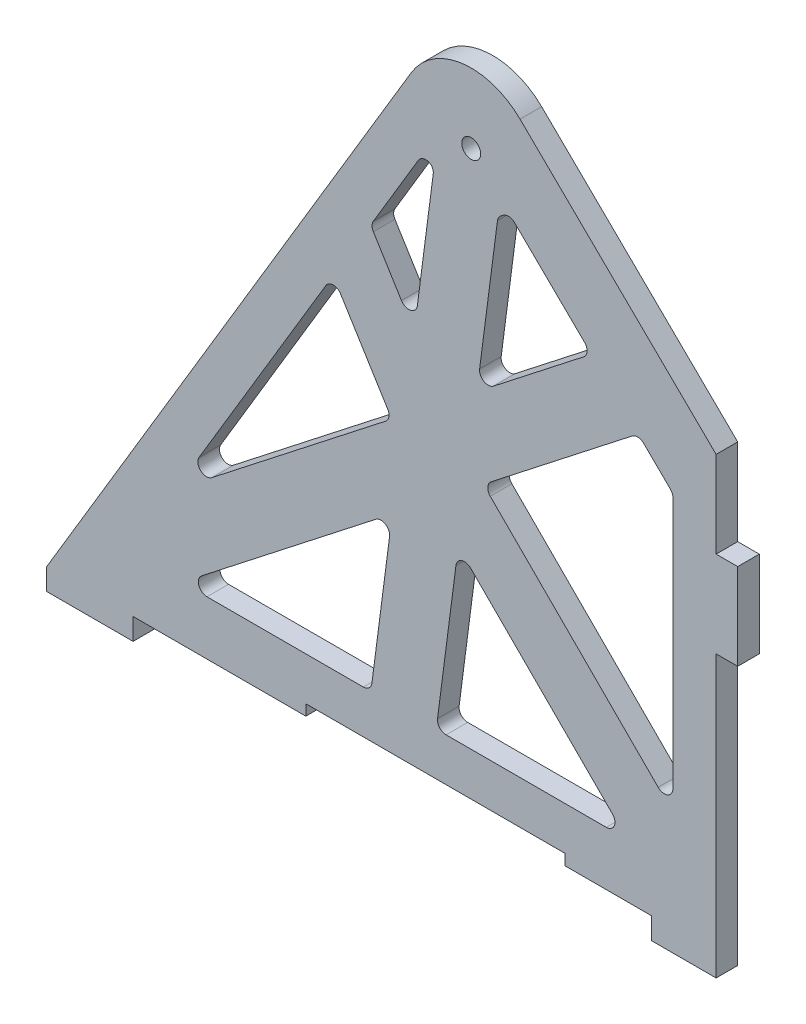
from build123d import *

# Parameters (mm, degrees)
SKETCH2_R           = 2.778125
BOSS_EXTRUDE1_DEPTH = 6.35
CUT_EXTRUDE1_DEPTH  = 280.596929737
FILLET1_R           = 2.54


with BuildPart() as part:
    # Sketch2 → Boss-Extrude1 (new body)
    with BuildSketch(Plane.XY):
        with BuildLine():
            Line((25.4, 2.542062626), (76.2, 2.542062626))
            Line((76.2, 2.542062626), (76.2, 5.717062626))
            Line((76.2, 5.717062626), (152.4, 5.717062626))
            Line((152.4, 5.717062626), (152.4, 2.542062626))
            Line((152.4, 2.542062626), (177.8, 2.542062626))
            Line((177.8, 2.542062626), (177.8, -3.807937374))
            Line((177.8, -3.807937374), (196.85, -3.807937374))
            Line((196.85, -3.807937374), (196.85, 78.742062626))
            Line((196.85, 78.742062626), (203.2, 78.742062626))
            Line((203.2, 78.742062626), (203.2, 104.142062626))
            Line((203.2, 104.142062626), (196.85, 104.142062626))
            Line((196.85, 104.142062626), (196.85, 129.542062626))
            Line((196.85, 129.542062626), (139.204596213, 186.076487834))
            ThreePointArc((139.204596213, 186.076487834), (122.208232851, 191.779061014), (107.214428724, 181.951469947))
            Line((107.214428724, 181.951469947), (0, 2.542062626))
            Line((0, 2.542062626), (0, -3.807937374))
            Line((0, -3.807937374), (25.4, -3.807937374))
            Line((25.4, -3.807937374), (25.4, 2.542062626))
        make_face()
        with Locations((124.833126, 171.422598626)):
            Circle(SKETCH2_R, mode=Mode.SUBTRACT)
    extrude(amount=BOSS_EXTRUDE1_DEPTH)

    # Sketch4 → Cut-Extrude1 (cut, through all)
    with BuildSketch(Plane.XY.offset(6.35)):
        with BuildLine():
            ThreePointArc((113.815309866, 160.551532388), (112.421969705, 162.174055338), (111.26558656, 163.973153877))
            Line((111.26558656, 163.973153877), (95.241664491, 137.159203595))
            Line((95.241664491, 137.159203595), (108.075962418, 116.386657845))
            Line((108.075962418, 116.386657845), (113.815309866, 160.551532388))
        make_face()
        with BuildLine():
            Line((160.218857543, 136.71884322), (135.883782706, 160.584917146))
            ThreePointArc((135.883782706, 160.584917146), (134.376571421, 159.23674605), (132.706463437, 158.096574796))
            Line((132.706463437, 158.096574796), (126.50513789, 110.376730818))
            Line((126.50513789, 110.376730818), (160.218857543, 136.71884322))
        make_face()
        Polygon((101.478261059, 90.822056657), (84.231843224, 118.735699112), (37.832728657, 41.092813319), align=None)
        Polygon((184.15, 113.248916833), (173.938776136, 123.263343551), (128.409628791, 87.689282626), (184.15, 31.894074467), align=None)
        Polygon((101.62722196, 66.762930434), (39.752190498, 18.417062626), (95.344542887, 18.417062626), align=None)
        Polygon((170.686233709, 18.417062626), (121.01587543, 68.136286224), (114.554724978, 18.417062626), align=None)
    extrude(amount=-CUT_EXTRUDE1_DEPTH, mode=Mode.SUBTRACT)

    # Fillet1
    # the kernel refuses this fillet: 2.54 mm, written as the material it adds along each edge
    with BuildSketch(Plane(origin=(101.478261059, 90.822056657, 6.35), x_dir=(-0.787987305363456, -0.6156914865304209, 0), z_dir=(0, 0, -1))) as fillet1_piece_1:
        with BuildLine():
            CenterArc((FILLET1_R * 0.89579463255, FILLET1_R), FILLET1_R, 186.292375304, 83.707624696)
            Line((-FILLET1_R * 0.0981809171118, FILLET1_R * 0.890397962274), (0, 0))
            Line((0, 0), (FILLET1_R * 0.89579463255, 0))
        make_face()
    extrude(amount=6.35)
    with BuildSketch(Plane(origin=(37.832728657, 41.092813319, 6.35), x_dir=(0.7879873053634544, 0.615691486530423, 0), z_dir=(0, 0, -1))) as fillet1_piece_2:
        with BuildLine():
            CenterArc((FILLET1_R * 5.36015588483, -FILLET1_R), FILLET1_R, 90, 158.864572417)
            Line((FILLET1_R * 4.9995822743, -FILLET1_R * 1.9327307604), (0, 0))
            Line((0, 0), (FILLET1_R * 5.36015588483, 0))
        make_face()
    extrude(amount=6.35)
    with BuildSketch(Plane(origin=(84.231843224, 118.735699112, 6.35), x_dir=(0.5256172693760891, -0.8507211565099483, 0), z_dir=(0, 0, -1))) as fillet1_piece_3:
        with BuildLine():
            CenterArc((FILLET1_R * 1.64561036796, FILLET1_R), FILLET1_R, 152.572197113, 117.427802887)
            Line((FILLET1_R * 0.758018400173, FILLET1_R * 1.46063054471), (0, 0))
            Line((0, 0), (FILLET1_R * 1.64561036796, 0))
        make_face()
    extrude(amount=6.35)
    with BuildSketch(Plane(origin=(111.26558656, 163.973153877, 6.35), x_dir=(-0.5129778962436395, -0.8584018161475719, 0), z_dir=(0, 0, -1))) as fillet1_piece_4:
        with BuildLine():
            CenterArc((3.871144204, -2.54), FILLET1_R, 90, 107.056570321)
            ThreePointArc((1.442864529, -3.285022026), (0.816940233, -1.600561505), (0, 0))
            Line((0, 0), (3.871144204, 0))
        make_face()
    extrude(amount=6.35)
    with BuildSketch(Plane(origin=(113.815309866, 160.551532388, 6.35), x_dir=(-0.12886916491369038, -0.9916616047495476, 0), z_dir=(0, 0, -1))) as fillet1_piece_5:
        with BuildLine():
            CenterArc((1.182123264, 2.54), FILLET1_R, 222.036471985, 47.963528015)
            ThreePointArc((-0.704382325, 0.839207048), (-0.344763298, 0.425838049), (0, 0))
            Line((0, 0), (1.182123264, 0))
        make_face()
    extrude(amount=6.35)
    with BuildSketch(Plane(origin=(108.075962418, 116.386657845, 6.35), x_dir=(-0.5256172693760838, 0.8507211565099515, 0), z_dir=(0, 0, -1))) as fillet1_piece_6:
        with BuildLine():
            CenterArc((FILLET1_R * 2.81500526937, FILLET1_R), FILLET1_R, 129.114057402, 140.885942598)
            Line((FILLET1_R * 2.18413907953, FILLET1_R * 1.77589164869), (0, 0))
            Line((0, 0), (FILLET1_R * 2.81500526937, 0))
        make_face()
    extrude(amount=6.35)
    with BuildSketch(Plane(origin=(95.241664491, 137.159203595, 6.35), x_dir=(0.5129778962436408, 0.8584018161475709, 0), z_dir=(0, 0, -1))) as fillet1_piece_7:
        with BuildLine():
            CenterArc((FILLET1_R * 0.607677260346, FILLET1_R), FILLET1_R, 207.427802887, 62.572197113)
            Line((-FILLET1_R * 0.279914707441, FILLET1_R * 0.539369455291), (0, 0))
            Line((0, 0), (FILLET1_R * 0.607677260346, 0))
        make_face()
    extrude(amount=6.35)
    with BuildSketch(Plane(origin=(39.752190498, 18.417062626, 6.35), x_dir=(0.787987305363458, 0.6156914865304186, 0), z_dir=(0, 0, -1))) as fillet1_piece_8:
        with BuildLine():
            CenterArc((FILLET1_R * 2.9040312307, FILLET1_R), FILLET1_R, 128.002182129, 141.997817871)
            Line((FILLET1_R * 2.28833974417, FILLET1_R * 1.78798730536), (0, 0))
            Line((0, 0), (FILLET1_R * 2.9040312307, 0))
        make_face()
    extrude(amount=6.35)
    with BuildSketch(Plane(origin=(101.62722196, 66.762930434, 6.35), x_dir=(-0.7879873053634603, -0.6156914865304155, 0), z_dir=(0, 0, -1))) as fillet1_piece_9:
        with BuildLine():
            CenterArc((FILLET1_R * 2.438641865, -FILLET1_R), FILLET1_R, 90, 135.406432707)
            Line((FILLET1_R * 1.73656875695, -FILLET1_R * 1.71210487357), (0, 0))
            Line((0, 0), (FILLET1_R * 2.438641865, 0))
        make_face()
    extrude(amount=6.35)
    with BuildSketch(Plane(origin=(95.344542887, 18.417062626, 6.35), x_dir=(-1, 0, 0), z_dir=(0, 0, -1))) as fillet1_piece_10:
        with BuildLine():
            CenterArc((FILLET1_R * 0.878455746309, FILLET1_R), FILLET1_R, 187.404250578, 82.595749422)
            Line((-FILLET1_R * 0.11320585844, FILLET1_R * 0.871130835086), (0, 0))
            Line((0, 0), (FILLET1_R * 0.878455746309, 0))
        make_face()
    extrude(amount=6.35)
    with BuildSketch(Plane(origin=(121.01587543, 68.136286224, 6.35), x_dir=(0.7067590436590283, -0.7074543477894356, 0), z_dir=(0, 0, -1))) as fillet1_piece_11:
        with BuildLine():
            CenterArc((FILLET1_R * 2.03333963012, FILLET1_R), FILLET1_R, 142.376080862, 127.623919138)
            Line((FILLET1_R * 1.2413047717, FILLET1_R * 1.61047586606), (0, 0))
            Line((0, 0), (FILLET1_R * 2.03333963012, 0))
        make_face()
    extrude(amount=6.35)
    with BuildSketch(Plane(origin=(170.686233709, 18.417062626, 6.35), x_dir=(-1, 0, 0), z_dir=(0, 0, -1))) as fillet1_piece_12:
        with BuildLine():
            CenterArc((FILLET1_R * 2.41253594524, FILLET1_R), FILLET1_R, 135.028169716, 134.971830284)
            Line((FILLET1_R * 1.70508159745, FILLET1_R * 1.70675904366), (0, 0))
            Line((0, 0), (FILLET1_R * 2.41253594524, 0))
        make_face()
    extrude(amount=6.35)
    with BuildSketch(Plane(origin=(114.554724978, 18.417062626, 6.35), x_dir=(1, 0, 0), z_dir=(0, 0, -1))) as fillet1_piece_13:
        with BuildLine():
            CenterArc((FILLET1_R * 1.13836127113, -FILLET1_R), FILLET1_R, 90, 97.404250578)
            Line((FILLET1_R * 0.14669966638, -FILLET1_R * 1.12886916491), (0, 0))
            Line((0, 0), (FILLET1_R * 1.13836127113, 0))
        make_face()
    extrude(amount=6.35)
    with BuildSketch(Plane(origin=(132.706463437, 158.096574796, 6.35), x_dir=(-0.12886916491355233, -0.9916616047495656, 0), z_dir=(0, 0, -1))) as fillet1_piece_14:
        with BuildLine():
            CenterArc((1.182123264, -2.54), FILLET1_R, 90, 47.963528015)
            ThreePointArc((-0.704382325, -0.839207048), (-0.344763298, -0.425838049), (0, 0))
            Line((0, 0), (1.182123264, 0))
        make_face()
    extrude(amount=6.35)
    with BuildSketch(Plane(origin=(135.883782706, 160.584917146, 6.35), x_dir=(0.7139531891838808, -0.7001934330270213, 0), z_dir=(0, 0, -1))) as fillet1_piece_15:
        with BuildLine():
            CenterArc((2.360070775, 2.54), FILLET1_R, 188.103931403, 81.896068597)
            ThreePointArc((-0.154564753, 2.181938326), (-0.038689543, 1.093703013), (0, 0))
            Line((0, 0), (2.360070775, 0))
        make_face()
    extrude(amount=6.35)
    with BuildSketch(Plane(origin=(160.218857543, 136.71884322, 6.35), x_dir=(-0.7879873053634604, -0.6156914865304155, 0), z_dir=(0, 0, -1))) as fillet1_piece_16:
        with BuildLine():
            CenterArc((FILLET1_R * 1.14139198058, FILLET1_R), FILLET1_R, 172.444707349, 97.555292651)
            Line((FILLET1_R * 0.150073543693, FILLET1_R * 1.13148291406), (0, 0))
            Line((0, 0), (FILLET1_R * 1.14139198058, 0))
        make_face()
    extrude(amount=6.35)
    with BuildSketch(Plane(origin=(126.50513789, 110.376730818, 6.35), x_dir=(0.1288691649135192, 0.9916616047495699, 0), z_dir=(0, 0, -1))) as fillet1_piece_17:
        with BuildLine():
            CenterArc((FILLET1_R * 2.438641865, FILLET1_R), FILLET1_R, 134.593567293, 135.406432707)
            Line((FILLET1_R * 1.73656875695, FILLET1_R * 1.71210487357), (0, 0))
            Line((0, 0), (FILLET1_R * 2.438641865, 0))
        make_face()
    extrude(amount=6.35)
    with BuildSketch(Plane(origin=(184.15, 113.248916833, 6.35), x_dir=(0, -1, 0), z_dir=(0, 0, -1))) as fillet1_piece_18:
        with BuildLine():
            CenterArc((FILLET1_R * 0.41992468346, FILLET1_R), FILLET1_R, 224.44252522, 45.55747478)
            Line((-FILLET1_R * 0.294028505724, FILLET1_R * 0.299806566973), (0, 0))
            Line((0, 0), (FILLET1_R * 0.41992468346, 0))
        make_face()
    extrude(amount=6.35)
    with BuildSketch(Plane(origin=(184.15, 31.894074467, 6.35), x_dir=(-0.7067590436590262, 0.7074543477894377, 0), z_dir=(0, 0, -1))) as fillet1_piece_19:
        with BuildLine():
            CenterArc((FILLET1_R * 2.41589317195, FILLET1_R), FILLET1_R, 134.971830284, 135.028169716)
            Line((FILLET1_R * 1.70913412829, FILLET1_R * 1.70745434779), (0, 0))
            Line((0, 0), (FILLET1_R * 2.41589317195, 0))
        make_face()
    extrude(amount=6.35)
    with BuildSketch(Plane(origin=(128.409628791, 87.689282626, 6.35), x_dir=(0.7879873053634587, 0.6156914865304174, 0), z_dir=(0, 0, -1))) as fillet1_piece_20:
        with BuildLine():
            CenterArc((FILLET1_R * 1.12969130859, FILLET1_R), FILLET1_R, 173.030351844, 96.969648156)
            Line((FILLET1_R * 0.137080737194, FILLET1_R * 1.12134353531), (0, 0))
            Line((0, 0), (FILLET1_R * 1.12969130859, 0))
        make_face()
    extrude(amount=6.35)
    with BuildSketch(Plane(origin=(173.938776136, 123.263343551, 6.35), x_dir=(-0.7879873053634626, -0.6156914865304124, 0), z_dir=(0, 0, -1))) as fillet1_piece_21:
        with BuildLine():
            CenterArc((FILLET1_R * 0.876123204837, -FILLET1_R), FILLET1_R, 90, 82.444707349)
            Line((-FILLET1_R * 0.115195232049, -FILLET1_R * 0.868517085939), (0, 0))
            Line((0, 0), (FILLET1_R * 0.876123204837, 0))
        make_face()
    extrude(amount=6.35)


solid = part.part
